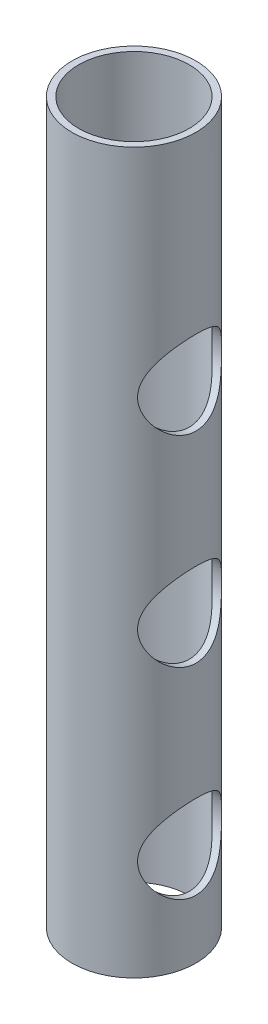
from build123d import *

# Parameters (mm, degrees)
SKETCH1_R           = 18.5
SKETCH1_R_2         = 16.5
BOSS_EXTRUDE1_DEPTH = 214.8
SKETCH2_R           = 12.53
CUT_EXTRUDE1_DEPTH  = 217.387476532


with BuildPart() as part:
    # Sketch1 → Boss-Extrude1 (new body)
    with BuildSketch(Plane(origin=(0, 0, 0), x_dir=(1, 0, 0), z_dir=(0, 1, 0))):
        Circle(SKETCH1_R)
        Circle(SKETCH1_R_2, mode=Mode.SUBTRACT)
    extrude(amount=BOSS_EXTRUDE1_DEPTH)

    # Sketch2 → Cut-Extrude1 (cut, through all)
    with BuildSketch(Plane(origin=(0, 0, 0), x_dir=(0, 0, -1), z_dir=(1, 0, 0))):
        with Locations((0, 150.1)):
            Circle(SKETCH2_R)
        with Locations((0, 90.1)):
            Circle(SKETCH2_R)
        with Locations((0, 30.1)):
            Circle(SKETCH2_R)
    extrude(amount=CUT_EXTRUDE1_DEPTH, mode=Mode.SUBTRACT)


solid = part.part
